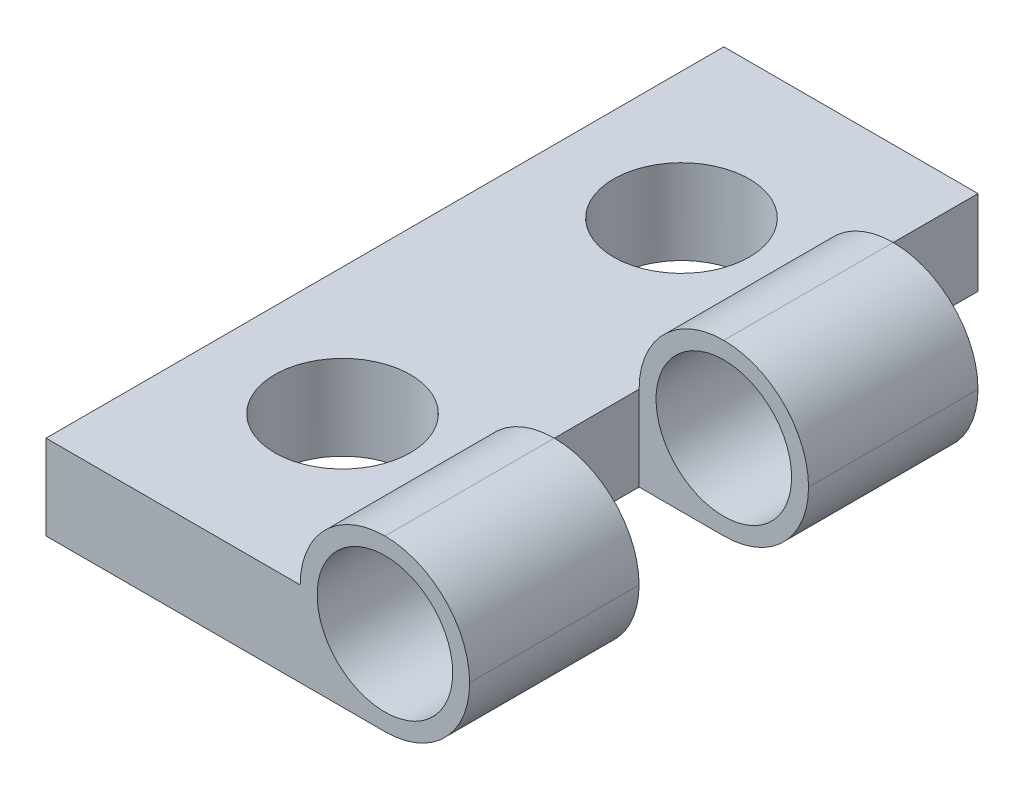
from build123d import *

# Parameters (mm, degrees)
SZKIC1_W                    = 15
SZKIC1_H                    = 40
DODANIE_WYCI_GNI_CIE1_DEPTH = 5
SZKIC2_W                    = 10
SZKIC2_H                    = 10
DODANIE_WYCI_GNI_CIE2_DEPTH = 10
SZKIC3_R                    = 4
WYTNIJ_WYCI_GNI_CIE1_DEPTH  = 30
ZAOKR_GLENIE1_R             = 5
SZKIC4_R                    = 4
WYTNIJ_WYCI_GNI_CIE2_DEPTH  = 30


with BuildPart() as part:
    # Szkic1 → Dodanie-wyciągnięcie1 (new body)
    with BuildSketch(Plane(origin=(0, 0, 0), x_dir=(1, 0, 0), z_dir=(0, 1, 0))):
        Rectangle(SZKIC1_W, SZKIC1_H)
    extrude(amount=DODANIE_WYCI_GNI_CIE1_DEPTH)

    # Szkic2 → Dodanie-wyciągnięcie2 (add)
    with BuildSketch(Plane(origin=(7.5, 0, 0), x_dir=(0, 0, -1), z_dir=(1, 0, 0))):
        with Locations((-15, 5)):
            Rectangle(SZKIC2_W, SZKIC2_H)
        with Locations((5, 5)):
            Rectangle(SZKIC2_W, SZKIC2_H)
    extrude(amount=DODANIE_WYCI_GNI_CIE2_DEPTH)

    # Szkic3 → Wytnij-wyciągnięcie1 (cut)
    with BuildSketch(Plane.XY.offset(20)):
        with Locations((12.5, 5)):
            Circle(SZKIC3_R)
    extrude(amount=-WYTNIJ_WYCI_GNI_CIE1_DEPTH, mode=Mode.SUBTRACT)

    # Zaokrąglenie1
    zaokr_glenie1_edges = [part.edges().sort_by_distance(p)[0] for p in [
        (7.5, 10, 15),
        (7.5, 10, -5),
        (17.5, 0, 15),
        (17.5, 0, -5),
        (17.5, 10, -5),
        (17.5, 10, 15),
    ]]
    fillet(zaokr_glenie1_edges, radius=ZAOKR_GLENIE1_R - 0.0001)  # a hair under: the kernel refuses the full size

    # Szkic4 → Wytnij-wyciągnięcie2 (cut)
    with BuildSketch(Plane(origin=(0, 5, 0), x_dir=(1, 0, 0), z_dir=(0, 1, 0))):
        with Locations(Location((0, 10, 0), (0, 0, 270))):
            Circle(SZKIC4_R)
        with Locations(Location((0, -10, 0), (0, 0, 270))):
            Circle(SZKIC4_R)
    extrude(amount=-WYTNIJ_WYCI_GNI_CIE2_DEPTH, mode=Mode.SUBTRACT)


solid = part.part
